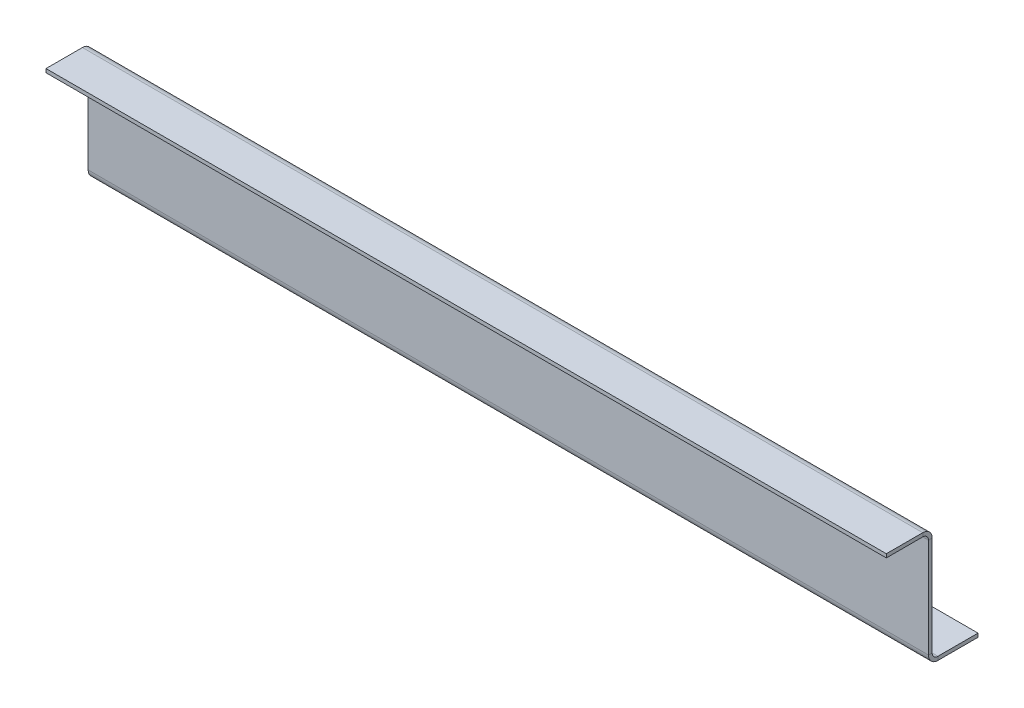
from build123d import *

# Parameters (mm, degrees)
BASE_FLANGE2_DEPTH = 279.4


# Sheet-metal steps are written as plain solids
with BuildPart() as part:
    # Sketch8 → Base-Flange2 (new body)
    with BuildSketch(Plane(origin=(0, 0, 0), x_dir=(0, 0, -1), z_dir=(1, 0, 0))):
        with BuildLine():
            Line((-15.24, 26.169154954), (-3.1242, 26.169154954))
            ThreePointArc((-3.1242, 26.169154954), (-0.915056994, 25.25409796), (0, 23.044954954))
            Line((0, 23.044954954), (0, -10.025845046))
            ThreePointArc((0, -10.025845046), (0.557961582, -11.372883464), (1.905, -11.930845046))
            Line((1.905, -11.930845046), (15.24, -11.930845046))
            Line((15.24, -11.930845046), (15.24, -13.150045046))
            Line((15.24, -13.150045046), (1.905, -13.150045046))
            ThreePointArc((1.905, -13.150045046), (-0.304143006, -12.234988051), (-1.2192, -10.025845046))
            Line((-1.2192, -10.025845046), (-1.2192, 23.044954954))
            ThreePointArc((-1.2192, 23.044954954), (-1.777161582, 24.391993373), (-3.1242, 24.949954954))
            Line((-3.1242, 24.949954954), (-15.24, 24.949954954))
            Line((-15.24, 24.949954954), (-15.24, 26.169154954))
        make_face()
    extrude(amount=BASE_FLANGE2_DEPTH)


solid = part.part
